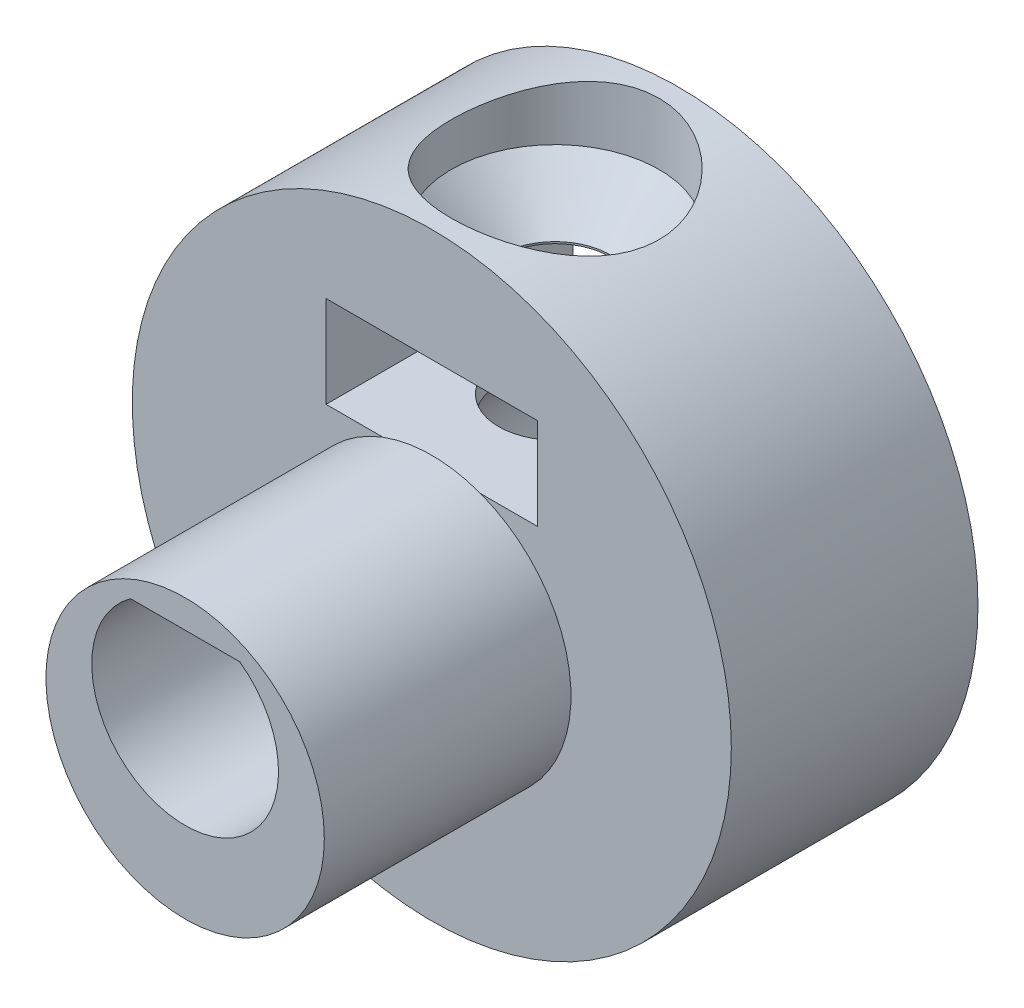
from build123d import *

# Parameters (mm, degrees)
ESQUISSE1_R             = 8.5
BOSS_EXTRU_1_DEPTH      = 7
ESQUISSE2_W             = 6
ESQUISSE2_H             = 2.6
ENL_V_MAT_EXTRU_1_DEPTH = 14.910427743
ESQUISSE7_R             = 2.95
ENL_V_MAT_EXTRU_8_DEPTH = 21.087060672
ESQUISSE9_R             = 3.95
BOSS_EXTRU_2_DEPTH      = 7
ENL_V_MAT_EXTRU_9_DEPTH = 19.45264218


with BuildPart() as part:
    # Esquisse1 → Boss.-Extru.1 (new body)
    with BuildSketch(Plane.XY):
        Circle(ESQUISSE1_R)
    extrude(amount=BOSS_EXTRU_1_DEPTH)

    # Esquisse2 → Enlèv. mat.-Extru.1 (cut, through all)
    with BuildSketch(Plane(origin=(0, 0, 0), x_dir=(-1, 0, 0), z_dir=(0, 0, -1))):
        with Locations((0, 4)):
            Rectangle(ESQUISSE2_W, ESQUISSE2_H)
    extrude(amount=-ENL_V_MAT_EXTRU_1_DEPTH, mode=Mode.SUBTRACT)

    # Enlèv. mat.-Extru.2: read off the stored shape, not the designer's step
    # Enlèv. mat.-Extru.2 outline → Enlèv. mat.-Extru.2 (revolve, cut)
    with BuildSketch(Plane.XY.offset(3.5)):
        Polygon((0, 5.3), (1.554616831, 5.3), (1.498760014, 8.500034923), (0, 8.500034923), align=None)
        Polygon((1.6, 2.7), (0, 2.7), (0, 0.7), (1.56508987, 0.7), align=None)
    revolve(axis=Axis((0, 0, 3.5), (0, 1, 0)), mode=Mode.SUBTRACT)

    # Esquisse7 → Enlèv. mat.-Extru.8 (cut, through all)
    with BuildSketch(Plane(origin=(0, 8.3, 0), x_dir=(1, 0, 0), z_dir=(0, 1, 0))):
        with Locations((0, -3.5)):
            Circle(ESQUISSE7_R)
    extrude(amount=ENL_V_MAT_EXTRU_8_DEPTH, mode=Mode.SUBTRACT)

    # Chanfrein1: read off the stored shape, not the designer's step
    # Chanfrein1 outline → Chanfrein1 (revolve, cut)
    with BuildSketch(Plane.XY.offset(3.5)):
        Polygon((2.95, 6.747748364), (2.95, 8.3), (1.502251636, 8.3), (1.553718474, 5.351466838), align=None)
    revolve(axis=Axis((0, 0, 3.5), (0, 1, 0)), mode=Mode.SUBTRACT)

    # Esquisse9 → Boss.-Extru.2 (add)
    with BuildSketch(Plane.XY.offset(7)):
        with Locations(Location((0, -1, 0), (0, 0, 110.493999506))):
            Circle(ESQUISSE9_R)
    extrude(amount=BOSS_EXTRU_2_DEPTH)

    # Esquisse10 → Enlèv. mat.-Extru.9 (cut, through all)
    with BuildSketch(Plane(origin=(0, 0, 0), x_dir=(-1, 0, 0), z_dir=(0, 0, -1))):
        with BuildLine():
            Line((-1.549193338, 2.15), (1.549193338, 2.15))
            ThreePointArc((1.549193338, 2.15), (0, -2.65), (-1.549193338, 2.15))
        make_face()
    extrude(amount=-ENL_V_MAT_EXTRU_9_DEPTH, mode=Mode.SUBTRACT)


solid = part.part
